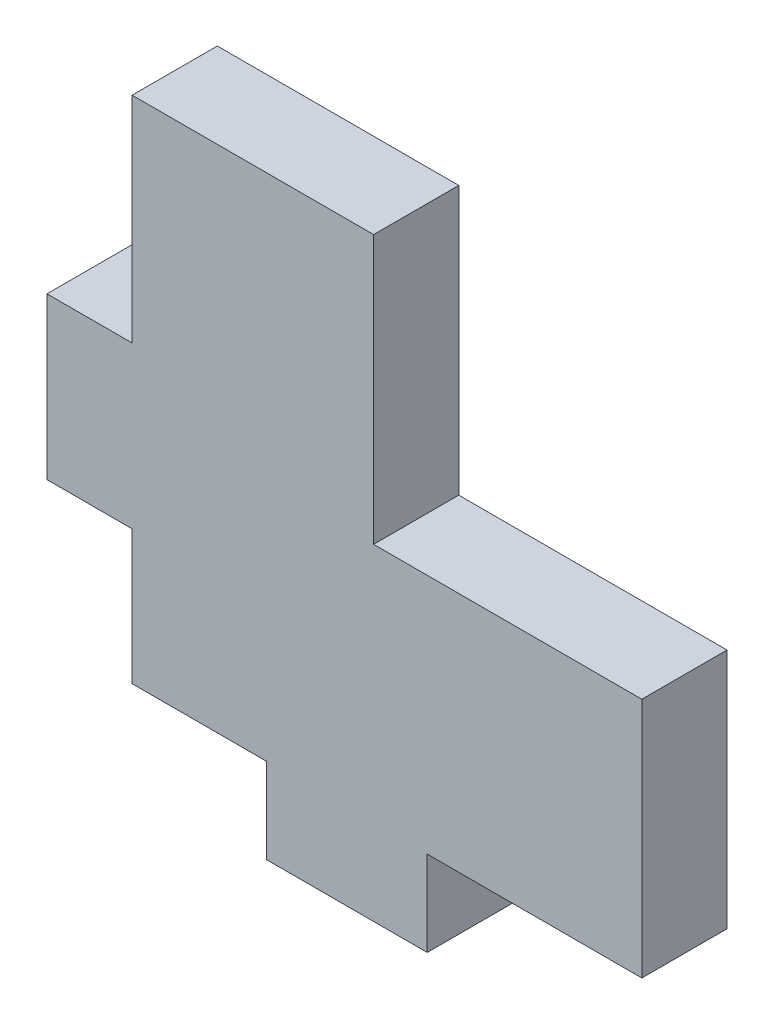
from build123d import *

# Parameters (mm, degrees)
BOSS_EXTRUDE1_DEPTH = 1.5875


with BuildPart() as part:
    # Sketch1 → Boss-Extrude1 (new, symmetric)
    with BuildSketch(Plane.XY):
        Polygon((0, 0), (5, 0), (5, -3.175), (11, -3.175), (11, 0), (19, 0), (19, 9), (9, 9), (9, 19), (0, 19), (0, 11), (-3.175, 11), (-3.175, 5), (0, 5), align=None)
    extrude(amount=BOSS_EXTRUDE1_DEPTH, both=True)


solid = part.part
